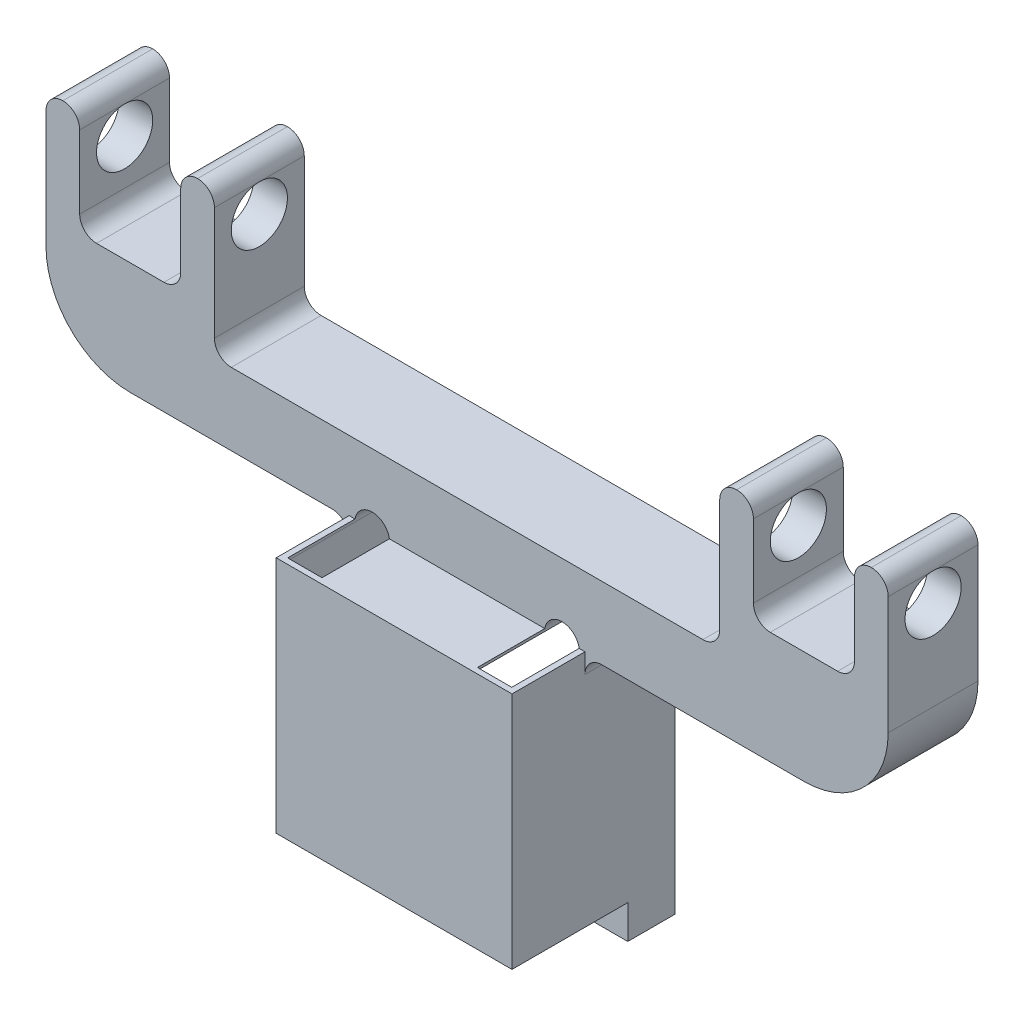
from build123d import *

# Parameters (mm, degrees)
ESQUISSE1_W                  = 150
ESQUISSE1_H                  = 120
BOSS_EXTRU_1_DEPTH           = 29
ENL_V_MAT_EXTRU_1_DEPTH      = 28
ENL_V_MAT_EXTRU_2_DEPTH      = 101.329457289
ENL_V_MAT_EXTRU_3_DEPTH      = 101.329457289
ENL_V_MAT_EXTRU_4_DEPTH      = 165.137137784
ENL_V_MAT_EXTRU_4_DEPTH_BACK = 165.137137784
ESQUISSE6_R                  = 5
ENL_V_MAT_EXTRU_6_DEPTH      = 165.137137784
ENL_V_MAT_EXTRU_6_DEPTH_BACK = 165.137137784
ENL_V_MAT_EXTRU_8_DEPTH      = 28
ESQUISSE13_R                 = 1.65
ENL_V_MAT_EXTRU_9_DEPTH      = 10
CONG_1_DEPTH                 = 30
CONG_2_R                     = 15
ESQUISSE14_W                 = 20.617821527
ESQUISSE14_H                 = 6
ENL_V_MAT_EXTRU_10_DEPTH     = 117.86316785
ENL_V_MAT_EXTRU_11_DEPTH     = 10
ENL_V_MAT_EXTRU_14_DEPTH     = 25
CONG_6_R                     = 3
ESQUISSE17_W                 = 39.451580469
ESQUISSE17_H                 = 13
ENL_V_MAT_EXTRU_15_DEPTH     = 22
ESQUISSE18_W                 = 3.388992405
ESQUISSE18_H                 = 13
ENL_V_MAT_EXTRU_16_DEPTH     = 22


with BuildPart() as part:
    # Esquisse1 → Boss.-Extru.1 (new body)
    with BuildSketch(Plane.XY):
        Rectangle(ESQUISSE1_W, ESQUISSE1_H)
    extrude(amount=BOSS_EXTRU_1_DEPTH)

    # Esquisse2 → Enlèv. mat.-Extru.1 (cut)
    with BuildSketch(Plane(origin=(0, 0, 0), x_dir=(-1, 0, 0), z_dir=(0, 0, -1))):
        with BuildLine():
            Line((-13.8, -12), (13.8, -12))
            ThreePointArc((13.8, -12), (16.9, -8.9), (20, -12))
            Line((20, -12), (20, -52))
            ThreePointArc((20, -52), (16.9, -55.1), (13.8, -52))
            Line((13.8, -52), (-13.8, -52))
            ThreePointArc((-13.8, -52), (-16.9, -55.1), (-20, -52))
            Line((-20, -52), (-20, -12))
            ThreePointArc((-20, -12), (-16.9, -8.9), (-13.8, -12))
        make_face()
    extrude(amount=-ENL_V_MAT_EXTRU_1_DEPTH, mode=Mode.SUBTRACT)

    # Esquisse3 → Enlèv. mat.-Extru.2 (cut, through all)
    with BuildSketch(Plane(origin=(0, 0, 0), x_dir=(-1, 0, 0), z_dir=(0, 0, -1))):
        with BuildLine():
            Line((-24, -12), (-75, -12))
            Line((-75, -12), (-75, -60))
            Line((-75, -60), (-21, -60))
            Line((-21, -60), (-21, -15))
            ThreePointArc((-21, -15), (-21.878679656, -12.878679656), (-24, -12))
        make_face()
        with BuildLine():
            Line((24, -12), (75, -12))
            Line((75, -12), (75, -60))
            Line((75, -60), (21, -60))
            Line((21, -60), (21, -15))
            ThreePointArc((21, -15), (21.878679656, -12.878679656), (24, -12))
        make_face()
    extrude(amount=-ENL_V_MAT_EXTRU_2_DEPTH, mode=Mode.SUBTRACT)

    # Esquisse5 → Enlèv. mat.-Extru.3 (cut, through all)
    with BuildSketch(Plane(origin=(0, 0, 0), x_dir=(-1, 0, 0), z_dir=(0, 0, -1))):
        with BuildLine():
            Line((-45, 60), (45, 60))
            Line((45, 60), (45, 3.874810027))
            ThreePointArc((45, 3.874810027), (44.121320344, 1.753489683), (42, 0.874810027))
            Line((42, 0.874810027), (-42, 0.874810027))
            ThreePointArc((-42, 0.874810027), (-44.121320344, 1.753489683), (-45, 3.874810027))
            Line((-45, 3.874810027), (-45, 60))
        make_face()
    extrude(amount=-ENL_V_MAT_EXTRU_3_DEPTH, mode=Mode.SUBTRACT)

    # Esquisse6 → Enlèv. mat.-Extru.4 (cut, two sides: drawn at the far end of the back side and taken through both)
    with BuildSketch(Plane.ZY.offset(75).offset(-ENL_V_MAT_EXTRU_4_DEPTH_BACK)):
        with Locations((8, 19)):
            Circle(ESQUISSE6_R)
    extrude(amount=ENL_V_MAT_EXTRU_4_DEPTH + ENL_V_MAT_EXTRU_4_DEPTH_BACK, mode=Mode.SUBTRACT)

    # Esquisse9 → Enlèv. mat.-Extru.6 (cut, two sides: drawn at the far end of the back side and taken through both)
    with BuildSketch(Plane.ZY.offset(75).offset(-ENL_V_MAT_EXTRU_6_DEPTH_BACK)):
        Polygon((0, 27), (16, 27), (16, -11.5), (29, -11.5), (29, 60), (0, 60), align=None)
    extrude(amount=ENL_V_MAT_EXTRU_6_DEPTH + ENL_V_MAT_EXTRU_6_DEPTH_BACK, mode=Mode.SUBTRACT)

    # Esquisse12 → Enlèv. mat.-Extru.8 (cut)
    with BuildSketch(Plane(origin=(0, 0, 0), x_dir=(-1, 0, 0), z_dir=(0, 0, -1))):
        with BuildLine():
            Line((-69, 27), (-69, 11))
            ThreePointArc((-69, 11), (-68.121320344, 8.878679656), (-66, 8))
            Line((-66, 8), (-54, 8))
            ThreePointArc((-54, 8), (-51.878679656, 8.878679656), (-51, 11))
            Line((-51, 11), (-51, 27))
            Line((-51, 27), (-69, 27))
        make_face()
    enl_v_mat_extru_8 = extrude(amount=-ENL_V_MAT_EXTRU_8_DEPTH, mode=Mode.SUBTRACT)

    # Symétrie1: Enlèv. mat.-Extru.8 across plane
    add(enl_v_mat_extru_8.mirror(Plane(origin=(0, 0, 0), x_dir=(0, 0, 1), z_dir=(1, 0, 0))), mode=Mode.SUBTRACT)

    # Esquisse13 → Enlèv. mat.-Extru.9 (cut)
    with BuildSketch(Plane(origin=(0, 0, 0), x_dir=(-1, 0, 0), z_dir=(0, 0, -1))):
        with Locations((-5.55, -8)):
            Circle(ESQUISSE13_R)
        with Locations((5.55, -8)):
            Circle(ESQUISSE13_R)
        with Locations((-6.55, -56)):
            Circle(ESQUISSE13_R)
        with Locations((5.55, -56)):
            Circle(ESQUISSE13_R)
    extrude(amount=-ENL_V_MAT_EXTRU_9_DEPTH, mode=Mode.SUBTRACT)

    # Congé1: read off the stored shape, not the designer's step
    # Congé1 outline → Congé1 (cut)
    with BuildSketch(Plane.XY):
        with BuildLine():
            Line((-75, -12), (-60, -12))
            ThreePointArc((-60, -12), (-70.606601718, -7.606601718), (-75, 3))
            Line((-75, 3), (-75, -12))
        make_face()
    extrude(amount=CONG_1_DEPTH, mode=Mode.SUBTRACT)

    # Congé2
    cong_2_edges = [part.edges().sort_by_distance(p)[0] for p in [
        (75, -12, 14.5),
    ]]
    fillet(cong_2_edges, radius=CONG_2_R)

    # Esquisse14 → Enlèv. mat.-Extru.10 (cut, through all)
    with BuildSketch(Plane.ZY.offset(21)):
        with Locations((18.691089237, -57)):
            Rectangle(ESQUISSE14_W, ESQUISSE14_H)
    extrude(amount=-ENL_V_MAT_EXTRU_10_DEPTH, mode=Mode.SUBTRACT)

    # Esquisse15 → Enlèv. mat.-Extru.11 (cut)
    with BuildSketch(Plane(origin=(0, -52, 0), x_dir=(1, 0, 0), z_dir=(0, 1, 0))):
        with BuildLine():
            Line((-13.5, -26), (-13.5, -25))
            ThreePointArc((-13.5, -25), (-12.914213562, -23.585786438), (-11.5, -23))
            Line((-11.5, -23), (-6.5, -23))
            ThreePointArc((-6.5, -23), (-5.085786438, -23.585786438), (-4.5, -25))
            Line((-4.5, -25), (-4.5, -26))
            ThreePointArc((-4.5, -26), (-5.085786438, -27.414213562), (-6.5, -28))
            Line((-6.5, -28), (-11.5, -28))
            ThreePointArc((-11.5, -28), (-12.914213562, -27.414213562), (-13.5, -26))
        make_face()
    enl_v_mat_extru_11 = extrude(amount=-ENL_V_MAT_EXTRU_11_DEPTH, mode=Mode.SUBTRACT)

    # Symétrie4: Enlèv. mat.-Extru.11 across plane
    add(enl_v_mat_extru_11.mirror(Plane(origin=(0, 0, 0), x_dir=(0, 0, 1), z_dir=(1, 0, 0))), mode=Mode.SUBTRACT)

    # Esquisse16 → Enlèv. mat.-Extru.14 (cut)
    with BuildSketch(Plane(origin=(0, 0, 0), x_dir=(-1, 0, 0), z_dir=(0, 0, -1))):
        with BuildLine():
            Line((-12, -53), (-7, -53))
            ThreePointArc((-7, -53), (-4.878679656, -52.121320344), (-4, -50))
            Line((-4, -50), (-15, -50))
            ThreePointArc((-15, -50), (-14.121320344, -52.121320344), (-12, -53))
        make_face()
    enl_v_mat_extru_14 = extrude(amount=-ENL_V_MAT_EXTRU_14_DEPTH, mode=Mode.SUBTRACT)

    # Symétrie5: Enlèv. mat.-Extru.14 across plane
    add(enl_v_mat_extru_14.mirror(Plane(origin=(0, 0, 0), x_dir=(0, 0, 1), z_dir=(1, 0, 0))), mode=Mode.SUBTRACT)

    # Congé6
    cong_6_edges = [part.edges().sort_by_distance(p)[0] for p in [
        (-75, 27, 8),
        (-69, 27, 8),
        (-45, 27, 8),
        (-51, 27, 8),
        (75, 27, 8),
        (69, 27, 8),
        (51, 27, 8),
        (45, 27, 8),
    ]]
    fillet(cong_6_edges, radius=CONG_6_R - 0.0001)  # a hair under: the kernel refuses the full size

    # Esquisse17 → Enlèv. mat.-Extru.15 (cut)
    with BuildSketch(Plane(origin=(0, -11.5, 0), x_dir=(1, 0, 0), z_dir=(0, 1, 0))):
        with Locations((44.114782639, -22.5)):
            Rectangle(ESQUISSE17_W, ESQUISSE17_H)
    enl_v_mat_extru_15 = extrude(amount=-ENL_V_MAT_EXTRU_15_DEPTH, mode=Mode.SUBTRACT)

    # Symétrie6: Enlèv. mat.-Extru.15 across plane
    add(enl_v_mat_extru_15.mirror(Plane(origin=(0, 0, 0), x_dir=(0, 0, 1), z_dir=(1, 0, 0))), mode=Mode.SUBTRACT)

    # Esquisse18 → Enlèv. mat.-Extru.16 (cut)
    with BuildSketch(Plane(origin=(0, -11.5, 0), x_dir=(1, 0, 0), z_dir=(0, 1, 0))):
        with Locations((22.694496202, -22.5)):
            Rectangle(ESQUISSE18_W, ESQUISSE18_H)
    enl_v_mat_extru_16 = extrude(amount=-ENL_V_MAT_EXTRU_16_DEPTH, mode=Mode.SUBTRACT)

    # Symétrie7: Enlèv. mat.-Extru.16 across plane
    add(enl_v_mat_extru_16.mirror(Plane(origin=(0, 0, 0), x_dir=(0, 0, 1), z_dir=(1, 0, 0))), mode=Mode.SUBTRACT)


solid = part.part
